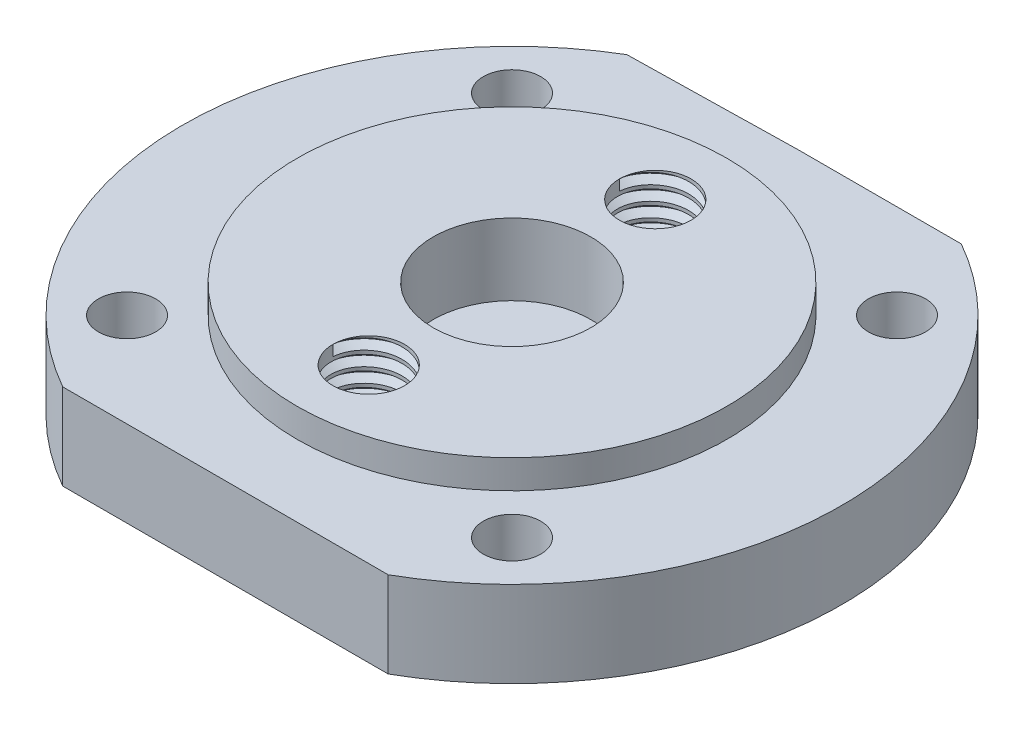
from build123d import *

# Parameters (mm, degrees)
BOSS_EXTRUDE1_DEPTH = 6
SKETCH2_R           = 2
CUT_EXTRUDE1_DEPTH  = 32.064449134
SKETCH3_R           = 15
BOSS_EXTRUDE2_DEPTH = 2
SKETCH4_R           = 5.5
CUT_EXTRUDE2_DEPTH  = 5
M6_TAPPED_HOLE1_D   = 5
THREAD1_PITCH       = 1
THREAD2_PITCH       = 1


with BuildPart() as part:
    # Sketch1 → Boss-Extrude1 (new body)
    with BuildSketch(Plane(origin=(0, 0, 0), x_dir=(1, 0, 0), z_dir=(0, 1, 0))):
        with BuildLine():
            Line((0, -20), (0, 0))
            Line((0, 0), (0, 19.998317487))
            Line((0, 19.998317487), (-11.756738356, 19.768133529))
            ThreePointArc((-11.756738356, 19.768133529), (-22.998842903, -0.230705741), (-11.357816692, -20))
            Line((-11.357816692, -20), (0, -20))
        make_face()
        with BuildLine():
            Line((0, 19.998317487), (0, 0))
            Line((0, 0), (0, -20))
            Line((0, -20), (11.357816692, -20))
            ThreePointArc((11.357816692, -20), (19.877497125, -11.570873262), (23, 0))
            ThreePointArc((23, 0), (19.878353996, 11.569401125), (11.360778922, 19.998317487))
            Line((11.360778922, 19.998317487), (0, 19.998317487))
        make_face()
    extrude(amount=BOSS_EXTRUDE1_DEPTH)

    # Sketch2 → Cut-Extrude1 (cut, through all)
    with BuildSketch(Plane(origin=(0, 6, 0), x_dir=(1, 0, 0), z_dir=(0, 1, 0))):
        with Locations(Location((-13.435028843, 13.435028843, 0), (0, 0, 270))):
            Circle(SKETCH2_R)
        with Locations(Location((13.435028843, 13.435028843, 0), (0, 0, 270))):
            Circle(SKETCH2_R)
        with Locations(Location((-13.435028843, -13.435028843, 0), (0, 0, 270))):
            Circle(SKETCH2_R)
        with Locations(Location((13.435028843, -13.435028843, 0), (0, 0, 270))):
            Circle(SKETCH2_R)
    extrude(amount=-CUT_EXTRUDE1_DEPTH, mode=Mode.SUBTRACT)

    # Sketch3 → Boss-Extrude2 (add)
    with BuildSketch(Plane(origin=(0, 6, 0), x_dir=(1, 0, 0), z_dir=(0, 1, 0))):
        with Locations(Location((0, 0, 0), (0, 0, 270))):
            Circle(SKETCH3_R)
    extrude(amount=BOSS_EXTRUDE2_DEPTH)

    # Sketch4 → Cut-Extrude2 (cut)
    with BuildSketch(Plane(origin=(0, 8, 0), x_dir=(1, 0, 0), z_dir=(0, 1, 0))):
        with Locations(Location((0, 0, 0), (0, 0, 270))):
            Circle(SKETCH4_R)
    extrude(amount=-CUT_EXTRUDE2_DEPTH, mode=Mode.SUBTRACT)

    # M6 Tapped Hole1 (through all)
    with Locations(Plane(origin=(0, 8, 0), x_dir=(1, 0, 0), z_dir=(0, 1, 0))):
        with Locations((0, 10), (0, -10)):
            Hole(M6_TAPPED_HOLE1_D / 2)

    # Thread1: arcs per turn and ends read off the stored shape
    # Thread1: the profile of Thread Profile1 profile screwed along a right-hand helix through 100 turns, 6 arcs to a turn; built about Z, then put on its axis
    thread1_z = Axis((0, 0, 0), (0, 0, 1))
    thread1_corners = [(2.4997, 0, -0.000173205), (3.041265875, 0, 0.312499999), (3.041265875, 0, 0.437499999), (2.4997, 0, 0.750173202)]
    with BuildLine(mode=Mode.PRIVATE) as thread1_profile:
        Line(thread1_corners[0], thread1_corners[1])
        Line(thread1_corners[1], thread1_corners[2])
        Line(thread1_corners[2], thread1_corners[3])
        Line(thread1_corners[3], thread1_corners[0])
    thread1_cap = Face(thread1_profile.wire())
    thread1_turn_angles = [0, 30, 60, 90, 120, 150, 180, 210, 240, 270, 300, 330, 360]
    thread1_turn_weights = [1, 0.8660254037844387, 1, 0.8660254037844387, 1, 0.8660254037844387, 1, 0.8660254037844387, 1, 0.8660254037844387, 1, 0.8660254037844387, 1]
    thread1_turn_rails = [Edge.make_bspline([Vector(p[0], p[1], 0).rotate(thread1_z, thread1_turn_angles[k]) / thread1_turn_weights[k] + Vector(0, 0, p[2] + THREAD1_PITCH * thread1_turn_angles[k] / 360) for k in range(13)], [0, 0, 0, 1, 1, 2, 2, 3, 3, 4, 4, 5, 5, 6, 6, 6], 2, thread1_turn_weights) for p in thread1_corners]
    thread1_turn_sides = [Face.make_surface_from_curves(thread1_turn_rails[p[0]], thread1_turn_rails[p[1]]) for p in [(0, 1), (1, 2), (2, 3), (3, 0)]]
    thread1 = Plane(origin=(0, 8, -10), x_dir=(-1, 0, 0), z_dir=(0, -1, 0)) * Solid(Shell([*[p.moved(Location((0, 0, THREAD1_PITCH * i))) for i in range(100) for p in thread1_turn_sides], thread1_cap, thread1_cap.rotate(thread1_z, 36000).moved(Location((0, 0, THREAD1_PITCH * 36000 / 360)))]))
    add(thread1, mode=Mode.SUBTRACT)

    # Thread2: arcs per turn and ends read off the stored shape
    # Thread2: the profile of Thread Profile2 profile screwed along a right-hand helix through 100 turns, 6 arcs to a turn; built about Z, then put on its axis
    thread2_z = Axis((0, 0, 0), (0, 0, 1))
    thread2_corners = [(2.4997, 0, -0.000173205), (3.041265875, 0, 0.312499999), (3.041265875, 0, 0.437499999), (2.4997, 0, 0.750173202)]
    with BuildLine(mode=Mode.PRIVATE) as thread2_profile:
        Line(thread2_corners[0], thread2_corners[1])
        Line(thread2_corners[1], thread2_corners[2])
        Line(thread2_corners[2], thread2_corners[3])
        Line(thread2_corners[3], thread2_corners[0])
    thread2_cap = Face(thread2_profile.wire())
    thread2_turn_angles = [0, 30, 60, 90, 120, 150, 180, 210, 240, 270, 300, 330, 360]
    thread2_turn_weights = [1, 0.8660254037844387, 1, 0.8660254037844387, 1, 0.8660254037844387, 1, 0.8660254037844387, 1, 0.8660254037844387, 1, 0.8660254037844387, 1]
    thread2_turn_rails = [Edge.make_bspline([Vector(p[0], p[1], 0).rotate(thread2_z, thread2_turn_angles[k]) / thread2_turn_weights[k] + Vector(0, 0, p[2] + THREAD2_PITCH * thread2_turn_angles[k] / 360) for k in range(13)], [0, 0, 0, 1, 1, 2, 2, 3, 3, 4, 4, 5, 5, 6, 6, 6], 2, thread2_turn_weights) for p in thread2_corners]
    thread2_turn_sides = [Face.make_surface_from_curves(thread2_turn_rails[p[0]], thread2_turn_rails[p[1]]) for p in [(0, 1), (1, 2), (2, 3), (3, 0)]]
    thread2 = Plane(origin=(0, 8, 10), x_dir=(-1, 0, 0), z_dir=(0, -1, 0)) * Solid(Shell([*[p.moved(Location((0, 0, THREAD2_PITCH * i))) for i in range(100) for p in thread2_turn_sides], thread2_cap, thread2_cap.rotate(thread2_z, 36000).moved(Location((0, 0, THREAD2_PITCH * 36000 / 360)))]))
    add(thread2, mode=Mode.SUBTRACT)


solid = part.part
